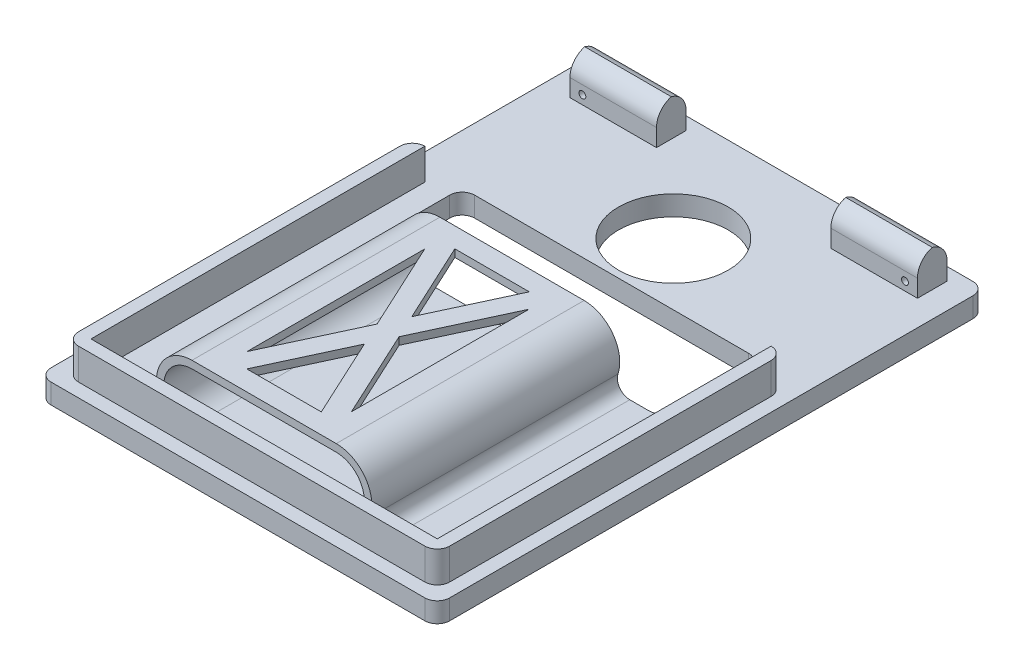
from build123d import *

# Parameters (mm, degrees)
BOSS_EXTRUDE1_DEPTH = 8
BOSS_EXTRUDE2_START = 8
SKETCH3_7_W         = 139.5
SKETCH3_7_H         = 11.9
BOSS_EXTRUDE2_DEPTH = 15
FILLET1_R           = 8
CUT_EXTRUDE1_REACH  = 139.901
BOSS_EXTRUDE3_DEPTH = 12.5
CUT_EXTRUDE2_REACH  = 232.432
SKETCH6_R           = 1.375
BOSS_EXTRUDE4_DEPTH = 99.5
FILLET2_R           = 5
CUT_EXTRUDE3_REACH  = 140.357
SKETCH9_W           = 70
SKETCH9_H           = 11.9
CUT_EXTRUDE4_REACH  = 142.044
CUT_EXTRUDE5_REACH  = 142.044
SKETCH11_R          = 22


with BuildPart() as part:
    # Sketch3 → Boss-Extrude1 (new body)
    with BuildSketch(Plane(origin=(0, 0, 0), x_dir=(1, 0, 0), z_dir=(0, 1, 0))):
        with BuildLine():
            Line((-75, 110), (75, 110))
            ThreePointArc((75, 110), (78.535533906, 108.535533906), (80, 105))
            Line((80, 105), (80, -105))
            ThreePointArc((80, -105), (78.535533906, -108.535533906), (75, -110))
            Line((75, -110), (-75, -110))
            ThreePointArc((-75, -110), (-78.535533906, -108.535533906), (-80, -105))
            Line((-80, -105), (-80, 105))
            ThreePointArc((-80, 105), (-78.535533906, 108.535533906), (-75, 110))
        make_face()
    extrude(amount=BOSS_EXTRUDE1_DEPTH)

    # Sketch3<7> → Boss-Extrude2 (add)
    with BuildSketch(Plane(origin=(0, 0, 0), x_dir=(1, 0, 0), z_dir=(0, 1, 0)).offset(BOSS_EXTRUDE2_START)):
        with Locations((0, 98.95)):
            Rectangle(SKETCH3_7_W, SKETCH3_7_H)
    extrude(amount=BOSS_EXTRUDE2_DEPTH)

    # Fillet1
    # the kernel refuses this fillet: 8 mm, written as the material it takes off along each edge
    with BuildSketch(Plane(origin=(89.75, 23, -93), x_dir=(0, -1, 0), z_dir=(-1, 0, 0)), Plane(origin=(-89.75, 23, -104.9), x_dir=(0, -1, 0), z_dir=(1, 0, 0))) as fillet1_piece_1:
        with BuildLine():
            CenterArc((FILLET1_R, -FILLET1_R), FILLET1_R, 90, 90)
            Line((0, -FILLET1_R), (0, 0))
            Line((0, 0), (FILLET1_R, 0))
        make_face()
    extrude(amount=179.5, mode=Mode.SUBTRACT)

    # Sketch4 → Cut-Extrude1 (cut, up to next)
    with BuildSketch(Plane.XZ, mode=Mode.PRIVATE) as cut_extrude1_sk1:
        with BuildLine():
            Line((-55, 0), (55, 0))
            ThreePointArc((55, 0), (58.535533906, -1.464466094), (60, -5))
            Line((60, -5), (60, -35))
            ThreePointArc((60, -35), (58.535533906, -38.535533906), (55, -40))
            Line((55, -40), (-55, -40))
            ThreePointArc((-55, -40), (-58.535533906, -38.535533906), (-60, -35))
            Line((-60, -35), (-60, -5))
            ThreePointArc((-60, -5), (-58.535533906, -1.464466094), (-55, 0))
        make_face()
    cut_extrude1_tool1 = extrude(cut_extrude1_sk1.sketch, amount=-CUT_EXTRUDE1_REACH, mode=Mode.PRIVATE) & part.part
    add(cut_extrude1_tool1.solids().sort_by_distance((0, 0, -20))[0], mode=Mode.SUBTRACT)

    # Sketch5 → Boss-Extrude3 (add)
    with BuildSketch(Plane(origin=(0, 8, 0), x_dir=(1, 0, 0), z_dir=(0, 1, 0))):
        with BuildLine():
            ThreePointArc((-69.5, -104.5), (-73.035533906, -103.035533906), (-74.5, -99.5))
            Line((-74.5, -99.5), (-74.5, 29.5))
            ThreePointArc((-74.5, 29.5), (-73.035533906, 33.035533906), (-69.5, 34.5))
            Line((-69.5, 34.5), (-69.5, -99.5))
            Line((-69.5, -99.5), (69.5, -99.5))
            Line((69.5, -99.5), (69.5, 34.5))
            ThreePointArc((69.5, 34.5), (73.035533906, 33.035533906), (74.5, 29.5))
            Line((74.5, 29.5), (74.5, -99.5))
            ThreePointArc((74.5, -99.5), (73.035533906, -103.035533906), (69.5, -104.5))
            Line((69.5, -104.5), (-69.5, -104.5))
        make_face()
    extrude(amount=BOSS_EXTRUDE3_DEPTH)

    # Sketch6 → Cut-Extrude2 (cut, up to next)
    with BuildSketch(Plane(origin=(0, 0, -104.9), x_dir=(-1, 0, 0), z_dir=(0, 0, -1)), mode=Mode.PRIVATE) as cut_extrude2_sk1:
        with Locations((-64.75, 11.5)):
            Circle(SKETCH6_R)
    cut_extrude2_tool1 = extrude(cut_extrude2_sk1.sketch, amount=-CUT_EXTRUDE2_REACH, mode=Mode.PRIVATE) & part.part
    # Sketch6 → Cut-Extrude2 (cut, up to next)
    with BuildSketch(Plane(origin=(0, 0, -104.9), x_dir=(-1, 0, 0), z_dir=(0, 0, -1)), mode=Mode.PRIVATE) as cut_extrude2_sk2:
        with Locations(Location((64.75, 11.5, 0), (0, 0, 180))):
            Circle(SKETCH6_R)
    cut_extrude2_tool2 = extrude(cut_extrude2_sk2.sketch, amount=-CUT_EXTRUDE2_REACH, mode=Mode.PRIVATE) & part.part
    add(cut_extrude2_tool1.solids().sort_by_distance((64.75, 11.5, -104.9))[0], mode=Mode.SUBTRACT)
    add(cut_extrude2_tool2.solids().sort_by_distance((-64.75, 11.5, -104.9))[0], mode=Mode.SUBTRACT)

    # Sketch8 → Boss-Extrude4 (add)
    with BuildSketch(Plane(origin=(0, 0, 99.5), x_dir=(-1, 0, 0), z_dir=(0, 0, -1))):
        with BuildLine():
            Line((-38.026756028, 8), (-31.313789331, 8))
            ThreePointArc((-31.313789331, 8), (-40.187326194, 20.238486432), (-28.95, 30.35))
            Line((-28.95, 30.35), (28.95, 30.35))
            ThreePointArc((28.95, 30.35), (40.187326194, 20.238486432), (31.313789331, 8))
            Line((31.313789331, 8), (38.026756028, 8))
            ThreePointArc((38.026756028, 8), (42.413004865, 23.870529017), (28.95, 33.35))
            Line((28.95, 33.35), (-28.95, 33.35))
            ThreePointArc((-28.95, 33.35), (-42.413004865, 23.870529017), (-38.026756028, 8))
        make_face()
    extrude(amount=BOSS_EXTRUDE4_DEPTH)

    # Fillet2
    fillet2_edges = [part.edges().sort_by_distance(p)[0] for p in [
        (-38.026756028, 8, 49.75),
        (38.026756028, 8, 49.75),
    ]]
    fillet(fillet2_edges, radius=FILLET2_R)

    # Sketch9 → Cut-Extrude3 (cut, up to next)
    with BuildSketch(Plane(origin=(0, 8, 0), x_dir=(1, 0, 0), z_dir=(0, 1, 0)), mode=Mode.PRIVATE) as cut_extrude3_sk1:
        with Locations((0, 98.95)):
            Rectangle(SKETCH9_W, SKETCH9_H)
    cut_extrude3_tool1 = extrude(cut_extrude3_sk1.sketch, amount=CUT_EXTRUDE3_REACH, mode=Mode.PRIVATE) & part.part
    add(cut_extrude3_tool1.solids().sort_by_distance((0, 8, -98.95))[0], mode=Mode.SUBTRACT)

    # Sketch10 → Cut-Extrude4 (cut, up to next)
    with BuildSketch(Plane(origin=(0, 33.35, 0), x_dir=(1, 0, 0), z_dir=(0, 1, 0)), mode=Mode.PRIVATE) as cut_extrude4_sk1:
        Polygon((4.409098458, -49.75), (20.95, -85.422252035), (20.95, -14.077747965), align=None)
    cut_extrude4_tool1 = extrude(cut_extrude4_sk1.sketch, amount=-CUT_EXTRUDE4_REACH, mode=Mode.PRIVATE) & part.part
    # Sketch10 → Cut-Extrude4 (cut, up to next)
    with BuildSketch(Plane(origin=(0, 33.35, 0), x_dir=(1, 0, 0), z_dir=(0, 1, 0)), mode=Mode.PRIVATE) as cut_extrude4_sk2:
        Polygon((0, -59.258700058), (-14.95, -91.5), (14.95, -91.5), align=None)
    cut_extrude4_tool2 = extrude(cut_extrude4_sk2.sketch, amount=-CUT_EXTRUDE4_REACH, mode=Mode.PRIVATE) & part.part
    # Sketch10 → Cut-Extrude4 (cut, up to next)
    with BuildSketch(Plane(origin=(0, 33.35, 0), x_dir=(1, 0, 0), z_dir=(0, 1, 0)), mode=Mode.PRIVATE) as cut_extrude4_sk3:
        Polygon((14.95, -8), (-14.95, -8), (0, -40.241299942), align=None)
    cut_extrude4_tool3 = extrude(cut_extrude4_sk3.sketch, amount=-CUT_EXTRUDE4_REACH, mode=Mode.PRIVATE) & part.part
    # Sketch10 → Cut-Extrude4 (cut, up to next)
    with BuildSketch(Plane(origin=(0, 33.35, 0), x_dir=(1, 0, 0), z_dir=(0, 1, 0)), mode=Mode.PRIVATE) as cut_extrude4_sk4:
        Polygon((-20.95, -14.077747965), (-20.95, -85.422252035), (-4.409098458, -49.75), align=None)
    cut_extrude4_tool4 = extrude(cut_extrude4_sk4.sketch, amount=-CUT_EXTRUDE4_REACH, mode=Mode.PRIVATE) & part.part
    add(cut_extrude4_tool1.solids().sort_by_distance((15.436366, 33.35, 49.75))[0], mode=Mode.SUBTRACT)
    add(cut_extrude4_tool2.solids().sort_by_distance((0, 33.35, 80.7529))[0], mode=Mode.SUBTRACT)
    add(cut_extrude4_tool3.solids().sort_by_distance((0, 33.35, 18.7471))[0], mode=Mode.SUBTRACT)
    add(cut_extrude4_tool4.solids().sort_by_distance((-15.436366, 33.35, 49.75))[0], mode=Mode.SUBTRACT)

    # Sketch11 → Cut-Extrude5 (cut, up to next)
    with BuildSketch(Plane.XZ, mode=Mode.PRIVATE) as cut_extrude5_sk1:
        with Locations(Location((0, -64.78, 0), (0, 0, 270))):
            Circle(SKETCH11_R)
    cut_extrude5_tool1 = extrude(cut_extrude5_sk1.sketch, amount=-CUT_EXTRUDE5_REACH, mode=Mode.PRIVATE) & part.part
    add(cut_extrude5_tool1.solids().sort_by_distance((0, 0, -64.78))[0], mode=Mode.SUBTRACT)


solid = part.part
